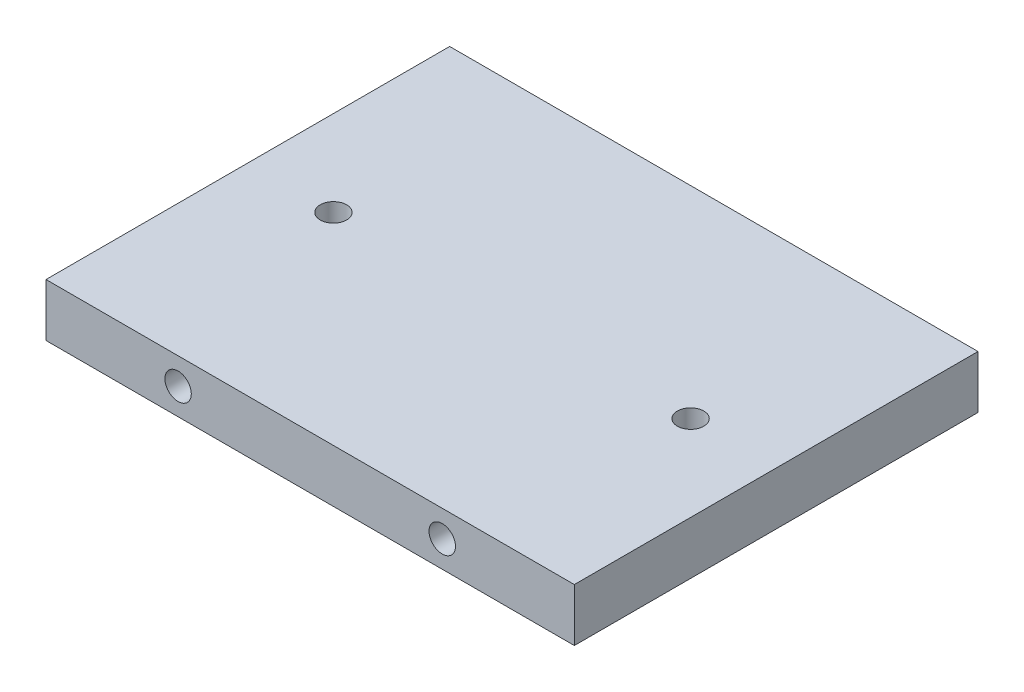
from build123d import *

# Parameters (mm, degrees)
SKETCH1_R           = 3.175
BOSS_EXTRUDE1_DEPTH = 12.7
SKETCH3_R           = 3.175
CUT_EXTRUDE1_DEPTH  = 117.653215918


with BuildPart() as part:
    # Sketch1 → Boss-Extrude1 (new body)
    with BuildSketch(Plane(origin=(0, 0, 0), x_dir=(1, 0, 0), z_dir=(0, 1, 0))):
        Polygon((0, 97.028), (63.5, 97.028), (63.5, 0), (-63.5, 0), (-63.5, 97.028), align=None)
        with Locations((-42.926, 48.514)):
            Circle(SKETCH1_R, mode=Mode.SUBTRACT)
        with Locations((42.926, 48.514)):
            Circle(SKETCH1_R, mode=Mode.SUBTRACT)
    extrude(amount=BOSS_EXTRUDE1_DEPTH)

    # Sketch3 → Cut-Extrude1 (cut, through all)
    with BuildSketch(Plane.XY):
        with Locations((-31.75, 6.35)):
            Circle(SKETCH3_R)
        with Locations((31.75, 6.35)):
            Circle(SKETCH3_R)
    extrude(amount=-CUT_EXTRUDE1_DEPTH, mode=Mode.SUBTRACT)


solid = part.part
